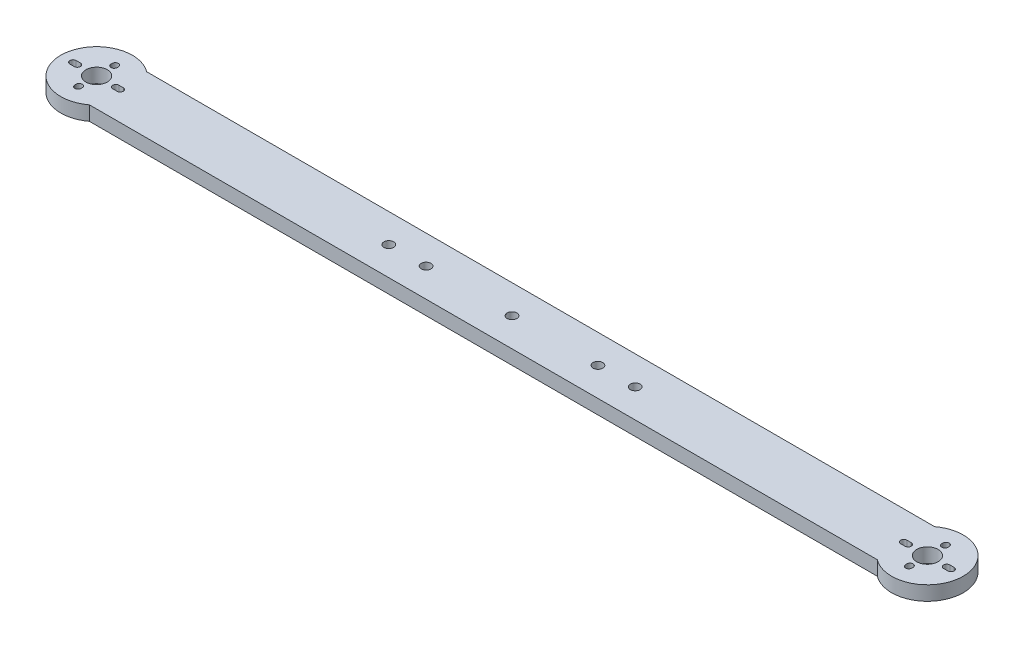
from build123d import *

# Parameters (mm, degrees)
BOSS_EXTRUDE1_DEPTH = 6.35
SKETCH2_R           = 4.75
CUT_EXTRUDE1_DEPTH  = 201.754423986
SKETCH3_R           = 2.159
CUT_EXTRUDE2_DEPTH  = 201.754423986
SKETCH4_R           = 2.159
CUT_EXTRUDE3_DEPTH  = 201.754423986


with BuildPart() as part:
    # Sketch1 → Boss-Extrude1 (new body)
    with BuildSketch(Plane(origin=(0, 0, 0), x_dir=(1, 0, 0), z_dir=(0, 1, 0))):
        with BuildLine():
            Line((-174.625, 12.7), (174.625, 12.7))
            ThreePointArc((174.625, 12.7), (200.025, 0), (174.625, -12.7))
            Line((174.625, -12.7), (-174.625, -12.7))
            ThreePointArc((-174.625, -12.7), (-200.025, 0), (-174.625, 12.7))
        make_face()
    extrude(amount=BOSS_EXTRUDE1_DEPTH)

    # Sketch2 → Cut-Extrude1 (cut, through all)
    with BuildSketch(Plane(origin=(0, 6.35, 0), x_dir=(1, 0, 0), z_dir=(0, 1, 0))):
        with Locations((184.15, 0)):
            Circle(SKETCH2_R)
        with Locations((-184.15, 0)):
            Circle(SKETCH2_R)
        with BuildLine():
            Line((173.691383345, 1.375), (175.608616655, 1.375))
            ThreePointArc((175.608616655, 1.375), (176.983616655, 0), (175.608616655, -1.375))
            Line((175.608616655, -1.375), (173.691383345, -1.375))
            ThreePointArc((173.691383345, -1.375), (172.316383345, 0), (173.691383345, 1.375))
        make_face()
        with BuildLine():
            Line((194.608616655, 1.375), (192.691383345, 1.375))
            ThreePointArc((192.691383345, 1.375), (191.316383345, 0), (192.691383345, -1.375))
            Line((192.691383345, -1.375), (194.608616655, -1.375))
            ThreePointArc((194.608616655, -1.375), (195.983616655, 0), (194.608616655, 1.375))
        make_face()
        with BuildLine():
            Line((185.525, 8.25), (185.525, 7.75))
            ThreePointArc((185.525, 7.75), (184.15, 6.375), (182.775, 7.75))
            Line((182.775, 7.75), (182.775, 8.25))
            ThreePointArc((182.775, 8.25), (184.15, 9.625), (185.525, 8.25))
        make_face()
        with BuildLine():
            Line((185.525, -8.25), (185.525, -7.75))
            ThreePointArc((185.525, -7.75), (184.15, -6.375), (182.775, -7.75))
            Line((182.775, -7.75), (182.775, -8.25))
            ThreePointArc((182.775, -8.25), (184.15, -9.625), (185.525, -8.25))
        make_face()
        with BuildLine():
            Line((-185.525, -8.25), (-185.525, -7.75))
            ThreePointArc((-185.525, -7.75), (-184.15, -6.375), (-182.775, -7.75))
            Line((-182.775, -7.75), (-182.775, -8.25))
            ThreePointArc((-182.775, -8.25), (-184.15, -9.625), (-185.525, -8.25))
        make_face()
        with BuildLine():
            Line((-185.525, 8.25), (-185.525, 7.75))
            ThreePointArc((-185.525, 7.75), (-184.15, 6.375), (-182.775, 7.75))
            Line((-182.775, 7.75), (-182.775, 8.25))
            ThreePointArc((-182.775, 8.25), (-184.15, 9.625), (-185.525, 8.25))
        make_face()
        with BuildLine():
            Line((-194.608616655, 1.375), (-192.691383345, 1.375))
            ThreePointArc((-192.691383345, 1.375), (-191.316383345, 0), (-192.691383345, -1.375))
            Line((-192.691383345, -1.375), (-194.608616655, -1.375))
            ThreePointArc((-194.608616655, -1.375), (-195.983616655, 0), (-194.608616655, 1.375))
        make_face()
        with BuildLine():
            Line((-173.691383345, 1.375), (-175.608616655, 1.375))
            ThreePointArc((-175.608616655, 1.375), (-176.983616655, 0), (-175.608616655, -1.375))
            Line((-175.608616655, -1.375), (-173.691383345, -1.375))
            ThreePointArc((-173.691383345, -1.375), (-172.316383345, 0), (-173.691383345, 1.375))
        make_face()
    extrude(amount=-CUT_EXTRUDE1_DEPTH, mode=Mode.SUBTRACT)

    # Sketch3 → Cut-Extrude2 (cut, through all)
    with BuildSketch(Plane(origin=(0, 6.35, 0), x_dir=(1, 0, 0), z_dir=(0, 1, 0))):
        Circle(SKETCH3_R)
        with Locations((38.1, 0)):
            Circle(SKETCH3_R)
        with Locations((-38.1, 0)):
            Circle(SKETCH3_R)
    extrude(amount=-CUT_EXTRUDE2_DEPTH, mode=Mode.SUBTRACT)

    # Sketch4 → Cut-Extrude3 (cut, through all)
    with BuildSketch(Plane(origin=(0, 6.35, 0), x_dir=(1, 0, 0), z_dir=(0, 1, 0))):
        with Locations((54.61, 0)):
            Circle(SKETCH4_R)
        with Locations((-54.61, 0)):
            Circle(SKETCH4_R)
    extrude(amount=-CUT_EXTRUDE3_DEPTH, mode=Mode.SUBTRACT)


solid = part.part
